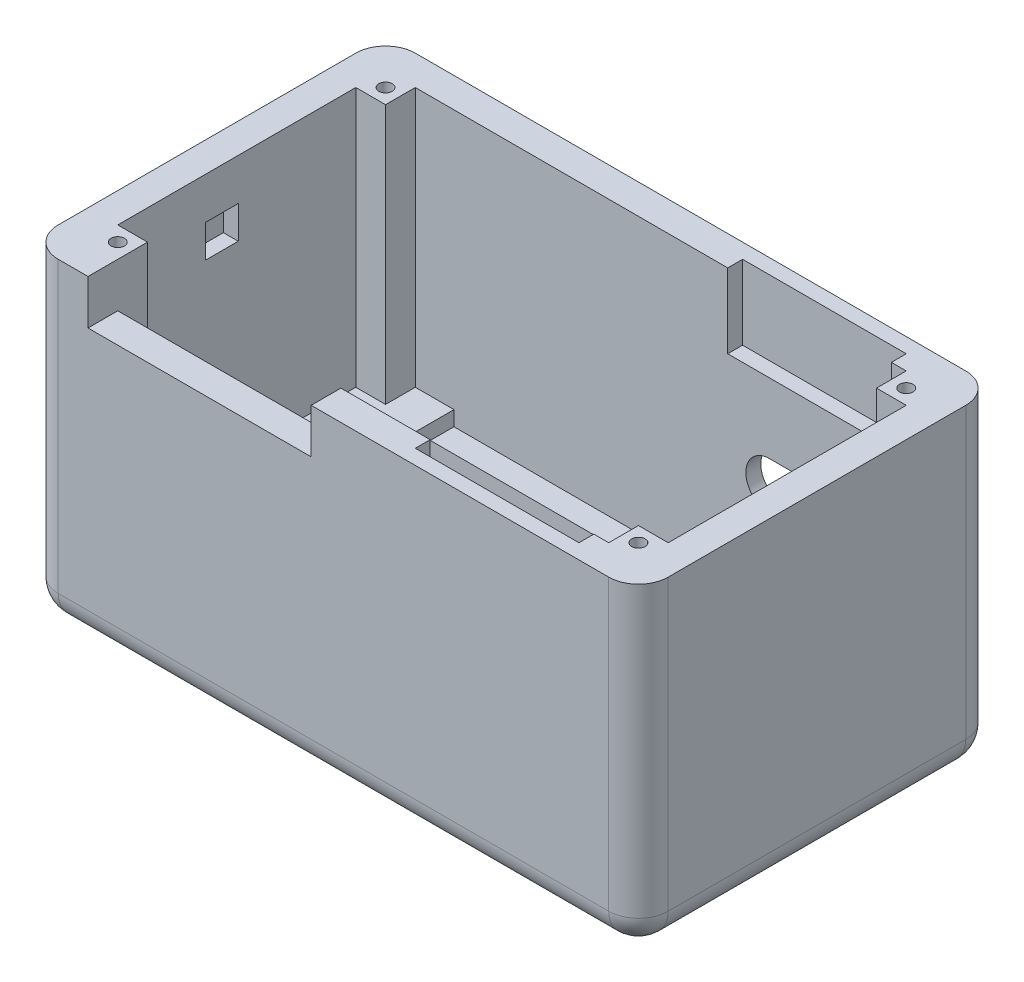
from build123d import *

# Parameters (mm, degrees)
SKETCH_1_W           = 41
SKETCH_1_H           = 24
EXTRUDE_1_DEPTH      = 21.45
SKETCH_2_W           = 37
SKETCH_2_H           = 20
CUT_EXTRUDE_1_DEPTH  = 18.45
SKETCH_4_W           = 15.21
SKETCH_4_H           = 15.21
CUT_EXTRUDE_2_DEPTH  = 15
SKETCH_6_W           = 15
SKETCH_6_H           = 3
CUT_EXTRUDE_4_DEPTH  = 5
CUT_EXTRUDE_7_DEPTH  = 1
CUT_EXTRUDE_8_DEPTH  = 1
SKETCH_11_W          = 35.5
SKETCH_11_H          = 17.6
CUT_EXTRUDE_10_DEPTH = 1.5
SKETCH_13_W          = 11
SKETCH_13_H          = 1
CUT_EXTRUDE_12_DEPTH = 5
FILLET_2_R           = 2
CHAMFER_2_SIZE       = 2
CHAMFER_2_SIZE_2     = 1.5
SKETCH_19_W          = 2.2
SKETCH_19_H          = 2.2
CUT_EXTRUDE_16_DEPTH = 1
SKETCH_21_W          = 3.8
SKETCH_21_H          = 1
SKETCH_21_W_2        = 3
EXTRUDE_4_DEPTH      = 3
FILLET_8_R           = 1
SKETCH_24_W          = 13.2
SKETCH_24_H          = 9.5
CUT_EXTRUDE_17_DEPTH = 1
EXTRUDE_6_REACH      = 80.427
SKETCH_27_W          = 4.6
SKETCH_27_H          = 1
SKETCH_28_W          = 2
SKETCH_28_H          = 2
EXTRUDE_7_DEPTH      = 17.45
SKETCH_29_R          = 0.45
CUT_EXTRUDE_18_DEPTH = 6


with BuildPart() as part:
    # 草图1 → 凸台-拉伸1 (new body)
    with BuildSketch(Plane(origin=(0, 0, 0), x_dir=(1, 0, 0), z_dir=(0, 1, 0))):
        with Locations((-51.657577391, -18.750418409)):
            Rectangle(SKETCH_1_W, SKETCH_1_H)
    extrude(amount=EXTRUDE_1_DEPTH)

    # 草图2 → 切除-拉伸1 (cut)
    with BuildSketch(Plane(origin=(0, 21.45, 0), x_dir=(1, 0, 0), z_dir=(0, 1, 0))):
        with Locations((-51.657577391, -18.750418409)):
            Rectangle(SKETCH_2_W, SKETCH_2_H)
    extrude(amount=-CUT_EXTRUDE_1_DEPTH, mode=Mode.SUBTRACT)

    # 草图4 → 切除-拉伸2 (cut)
    with BuildSketch(Plane(origin=(0, 0, 0), x_dir=(-1, 0, 0), z_dir=(0, -1, 0))):
        with Locations((61.352577391, -19.145418409)):
            Rectangle(SKETCH_4_W, SKETCH_4_H)
    extrude(amount=-CUT_EXTRUDE_2_DEPTH, mode=Mode.SUBTRACT)

    # 草图6 → 切除-拉伸4 (cut)
    with BuildSketch(Plane.XY.offset(30.750418409)):
        with Locations((-60.657577391, 19.95)):
            Rectangle(SKETCH_6_W, SKETCH_6_H)
    extrude(amount=-CUT_EXTRUDE_4_DEPTH, mode=Mode.SUBTRACT)

    # 草图7 → 切除-拉伸7 (cut)
    with BuildSketch(Plane(origin=(0, 0, 6.750418409), x_dir=(-1, 0, 0), z_dir=(0, 0, -1))):
        with BuildLine():
            Line((44.337577391, 6.55), (38.137577391, 6.55))
            ThreePointArc((38.137577391, 6.55), (34.537577391, 10.15), (38.137577391, 13.75))
            Line((38.137577391, 13.75), (44.337577391, 13.75))
            ThreePointArc((44.337577391, 13.75), (47.937577391, 10.15), (44.337577391, 6.55))
        make_face()
    extrude(amount=-CUT_EXTRUDE_7_DEPTH, mode=Mode.SUBTRACT)

    # 草图9 → 切除-拉伸8 (cut)
    with BuildSketch(Plane(origin=(0, 0, 7.750418409), x_dir=(-1, 0, 0), z_dir=(0, 0, -1))):
        with BuildLine():
            Line((44.337577391, 8.55), (38.537577391, 8.55))
            ThreePointArc((38.537577391, 8.55), (36.937577391, 10.15), (38.537577391, 11.75))
            Line((38.537577391, 11.75), (44.337577391, 11.75))
            ThreePointArc((44.337577391, 11.75), (45.937577391, 10.15), (44.337577391, 8.55))
        make_face()
    extrude(amount=-CUT_EXTRUDE_8_DEPTH, mode=Mode.SUBTRACT)

    # 草图11 → 切除-拉伸10 (cut)
    with BuildSketch(Plane(origin=(0, 3, 0), x_dir=(1, 0, 0), z_dir=(0, 1, 0))):
        with Locations((-52.407577391, -19.140418409)):
            Rectangle(SKETCH_11_W, SKETCH_11_H)
    extrude(amount=-CUT_EXTRUDE_10_DEPTH, mode=Mode.SUBTRACT)

    # 草图13 → 切除-拉伸12 (cut)
    with BuildSketch(Plane(origin=(0, 21.45, 0), x_dir=(1, 0, 0), z_dir=(0, 1, 0))):
        with Locations((-41.657577391, -29.250418409)):
            Rectangle(SKETCH_13_W, SKETCH_13_H)
        with Locations((-41.657577391, -8.250418409)):
            Rectangle(SKETCH_13_W, SKETCH_13_H)
    extrude(amount=-CUT_EXTRUDE_12_DEPTH, mode=Mode.SUBTRACT)

    # 圆角2
    fillet_2_edges = [part.edges().sort_by_distance(p)[0] for p in [
        (-72.157577391, 0, 18.750418409),
        (-51.657577391, 0, 30.750418409),
        (-31.157577391, 0, 18.750418409),
        (-51.657577391, 0, 6.750418409),
        (-72.157577391, 10.725, 6.750418409),
        (-72.157577391, 10.725, 30.750418409),
        (-31.157577391, 10.725, 30.750418409),
        (-31.157577391, 10.725, 6.750418409),
    ]]
    fillet(fillet_2_edges, radius=FILLET_2_R)

    # 倒角2
    # the kernel refuses this chamfer: 2, 1.5 mm, written as the material it takes off along each edge
    with BuildSketch(Plane(origin=(-53.747577391, 0, 26.750418409), x_dir=(0, -0.02324952774876386, 0.9997296931968459), z_dir=(-1, 0, 0)), Plane(origin=(-53.747577391, 0, 11.540418409), x_dir=(0.9997296931968459, -0.02324952774876386, 0), z_dir=(0, 0, 1)), Plane(origin=(-68.957577391, 0, 11.540418409), x_dir=(0, -0.02324952774876386, -0.9997296931968459), z_dir=(1, 0, 0)), Plane(origin=(-68.957577391, 0, 26.750418409), x_dir=(-0.9997296931968459, -0.02324952774876394, 0), z_dir=(0, 0, -1))) as chamfer_2_piece_1:
        Polygon((CHAMFER_2_SIZE * 0.999729693197, CHAMFER_2_SIZE * 0.0232495277488), (-CHAMFER_2_SIZE_2 * 0.0232495277488, CHAMFER_2_SIZE_2 * 0.999729693197), (0, 0), align=None)
    extrude(amount=15.21, mode=Mode.SUBTRACT)
    with BuildSketch(Plane(origin=(-48.58618223, 0, 26.750418409), x_dir=(0, -0.02324952774876386, 0.9997296931968459), z_dir=(-1, 0, 0))) as chamfer_2_piece_2a_section:
        Polygon((CHAMFER_2_SIZE * 0.999729693197, CHAMFER_2_SIZE * 0.0232495277488), (-CHAMFER_2_SIZE_2 * 0.0232495277488, CHAMFER_2_SIZE_2 * 0.999729693197), (0, 0), align=None)
    chamfer_2_piece_2a = extrude(amount=20.37139516, mode=Mode.PRIVATE)
    chamfer_2_piece_2a = split(chamfer_2_piece_2a, bisect_by=Plane(origin=(-53.747577391, 0.488589108, 27.415308917), z_dir=(1, 0, 0)), keep=Keep.TOP, mode=Mode.PRIVATE)
    with BuildSketch(Plane(origin=(-53.747577391, 0, 11.540418409), x_dir=(0.9997296931968459, -0.02324952774876386, 0), z_dir=(0, 0, 1))) as chamfer_2_piece_2b_section:
        Polygon((CHAMFER_2_SIZE * 0.999729693197, CHAMFER_2_SIZE * 0.0232495277488), (-CHAMFER_2_SIZE_2 * 0.0232495277488, CHAMFER_2_SIZE_2 * 0.999729693197), (0, 0), align=None)
    chamfer_2_piece_2b = extrude(amount=20.37139516, mode=Mode.PRIVATE)
    chamfer_2_piece_2b = split(chamfer_2_piece_2b, bisect_by=Plane(origin=(-53.082686882, 0.488589108, 26.750418409), z_dir=(0, 0, 1)), keep=Keep.TOP, mode=Mode.PRIVATE)
    chamfer_2_piece_2 = chamfer_2_piece_2a & chamfer_2_piece_2b
    add(chamfer_2_piece_2, mode=Mode.SUBTRACT)
    with BuildSketch(Plane(origin=(-68.957577391, 0, 31.911813569), x_dir=(-0.9997296931968459, -0.02324952774876394, 0), z_dir=(0, 0, -1))) as chamfer_2_piece_3a_section:
        Polygon((CHAMFER_2_SIZE * 0.999729693197, CHAMFER_2_SIZE * 0.0232495277488), (-CHAMFER_2_SIZE_2 * 0.0232495277488, CHAMFER_2_SIZE_2 * 0.999729693197), (0, 0), align=None)
    chamfer_2_piece_3a = extrude(amount=20.37139516, mode=Mode.PRIVATE)
    chamfer_2_piece_3a = split(chamfer_2_piece_3a, bisect_by=Plane(origin=(-69.622467899, 0.488589108, 26.750418409), z_dir=(0, 0, 1)), keep=Keep.TOP, mode=Mode.PRIVATE)
    with BuildSketch(Plane(origin=(-53.747577391, 0, 26.750418409), x_dir=(0, -0.02324952774876386, 0.9997296931968459), z_dir=(-1, 0, 0))) as chamfer_2_piece_3b_section:
        Polygon((CHAMFER_2_SIZE * 0.999729693197, CHAMFER_2_SIZE * 0.0232495277488), (-CHAMFER_2_SIZE_2 * 0.0232495277488, CHAMFER_2_SIZE_2 * 0.999729693197), (0, 0), align=None)
    chamfer_2_piece_3b = extrude(amount=20.37139516, mode=Mode.PRIVATE)
    chamfer_2_piece_3b = split(chamfer_2_piece_3b, bisect_by=Plane(origin=(-68.957577391, 0.488589108, 27.415308917), z_dir=(-1, 0, 0)), keep=Keep.TOP, mode=Mode.PRIVATE)
    chamfer_2_piece_3 = chamfer_2_piece_3a & chamfer_2_piece_3b
    add(chamfer_2_piece_3, mode=Mode.SUBTRACT)
    with BuildSketch(Plane(origin=(-53.747577391, 0, 6.379023249), x_dir=(0.9997296931968459, -0.02324952774876386, 0), z_dir=(0, 0, 1))) as chamfer_2_piece_4a_section:
        Polygon((CHAMFER_2_SIZE * 0.999729693197, CHAMFER_2_SIZE * 0.0232495277488), (-CHAMFER_2_SIZE_2 * 0.0232495277488, CHAMFER_2_SIZE_2 * 0.999729693197), (0, 0), align=None)
    chamfer_2_piece_4a = extrude(amount=20.37139516, mode=Mode.PRIVATE)
    chamfer_2_piece_4a = split(chamfer_2_piece_4a, bisect_by=Plane(origin=(-53.082686882, 0.488589108, 11.540418409), z_dir=(0, 0, -1)), keep=Keep.TOP, mode=Mode.PRIVATE)
    with BuildSketch(Plane(origin=(-68.957577391, 0, 11.540418409), x_dir=(0, -0.02324952774876386, -0.9997296931968459), z_dir=(1, 0, 0))) as chamfer_2_piece_4b_section:
        Polygon((CHAMFER_2_SIZE * 0.999729693197, CHAMFER_2_SIZE * 0.0232495277488), (-CHAMFER_2_SIZE_2 * 0.0232495277488, CHAMFER_2_SIZE_2 * 0.999729693197), (0, 0), align=None)
    chamfer_2_piece_4b = extrude(amount=20.37139516, mode=Mode.PRIVATE)
    chamfer_2_piece_4b = split(chamfer_2_piece_4b, bisect_by=Plane(origin=(-53.747577391, 0.488589108, 10.875527901), z_dir=(1, 0, 0)), keep=Keep.TOP, mode=Mode.PRIVATE)
    chamfer_2_piece_4 = chamfer_2_piece_4a & chamfer_2_piece_4b
    add(chamfer_2_piece_4, mode=Mode.SUBTRACT)
    with BuildSketch(Plane(origin=(-68.957577391, 0, 26.750418409), x_dir=(-0.9997296931968459, -0.02324952774876394, 0), z_dir=(0, 0, -1))) as chamfer_2_piece_5a_section:
        Polygon((CHAMFER_2_SIZE * 0.999729693197, CHAMFER_2_SIZE * 0.0232495277488), (-CHAMFER_2_SIZE_2 * 0.0232495277488, CHAMFER_2_SIZE_2 * 0.999729693197), (0, 0), align=None)
    chamfer_2_piece_5a = extrude(amount=20.37139516, mode=Mode.PRIVATE)
    chamfer_2_piece_5a = split(chamfer_2_piece_5a, bisect_by=Plane(origin=(-69.622467899, 0.488589108, 11.540418409), z_dir=(0, 0, -1)), keep=Keep.TOP, mode=Mode.PRIVATE)
    with BuildSketch(Plane(origin=(-74.118972551, 0, 11.540418409), x_dir=(0, -0.02324952774876386, -0.9997296931968459), z_dir=(1, 0, 0))) as chamfer_2_piece_5b_section:
        Polygon((CHAMFER_2_SIZE * 0.999729693197, CHAMFER_2_SIZE * 0.0232495277488), (-CHAMFER_2_SIZE_2 * 0.0232495277488, CHAMFER_2_SIZE_2 * 0.999729693197), (0, 0), align=None)
    chamfer_2_piece_5b = extrude(amount=20.37139516, mode=Mode.PRIVATE)
    chamfer_2_piece_5b = split(chamfer_2_piece_5b, bisect_by=Plane(origin=(-68.957577391, 0.488589108, 10.875527901), z_dir=(-1, 0, 0)), keep=Keep.TOP, mode=Mode.PRIVATE)
    chamfer_2_piece_5 = chamfer_2_piece_5a & chamfer_2_piece_5b
    add(chamfer_2_piece_5, mode=Mode.SUBTRACT)

    # 草图19 → 切除-拉伸16 (cut)
    with BuildSketch(Plane(origin=(-70.157577391, 0, 0), x_dir=(0, 0, -1), z_dir=(1, 0, 0))):
        with Locations((-19.750418409, 17.55)):
            Rectangle(SKETCH_19_W, SKETCH_19_H)
    extrude(amount=-CUT_EXTRUDE_16_DEPTH, mode=Mode.SUBTRACT)

    # 草图21 → 凸台-拉伸4 (add)
    with BuildSketch(Plane.ZY.offset(33.157577391)):
        with Locations((10.650418409, 3.5)):
            Rectangle(SKETCH_21_W, SKETCH_21_H)
        with Locations((27.250418409, 3.5)):
            Rectangle(SKETCH_21_W_2, SKETCH_21_H)
    extrude(amount=EXTRUDE_4_DEPTH)

    # 圆角8
    # the kernel refuses this fillet: 1 mm, written as the material it takes off along each edge
    with BuildSketch(Plane(origin=(-34.657577391, 3, 28.250418409), x_dir=(1, 0, 0), z_dir=(0, 0, -1))) as fillet_8_piece_1_section:
        with BuildLine():
            CenterArc((FILLET_8_R, FILLET_8_R), FILLET_8_R, 180, 90)
            Line((0, FILLET_8_R), (0, 0))
            Line((0, 0), (FILLET_8_R, 0))
        make_face()
    fillet_8_piece_1 = extrude(amount=15.7, mode=Mode.PRIVATE)
    fillet_8_piece_1 = split(fillet_8_piece_1, bisect_by=Plane(origin=(-34.454104261, 2.75304895, 27.940418409), z_dir=(0, 0, -1)), keep=Keep.TOP, mode=Mode.PRIVATE)
    fillet_8_piece_1 = split(fillet_8_piece_1, bisect_by=Plane(origin=(-34.454104261, 2.75304895, 25.750418409), z_dir=(0, 0, 1)), keep=Keep.TOP, mode=Mode.PRIVATE)
    fillet_8_piece_1 = split(fillet_8_piece_1, bisect_by=Plane(origin=(-34.454104261, 3, 26.845418409), z_dir=(0, -1, 0)), keep=Keep.TOP, mode=Mode.PRIVATE)
    add(fillet_8_piece_1, mode=Mode.SUBTRACT)
    with BuildSketch(Plane(origin=(-34.657577391, 3, 25.750418409), x_dir=(1, 0, 0), z_dir=(0, 0, -1))) as fillet_8_piece_2_section:
        with BuildLine():
            CenterArc((FILLET_8_R, FILLET_8_R), FILLET_8_R, 180, 90)
            Line((0, FILLET_8_R), (0, 0))
            Line((0, 0), (FILLET_8_R, 0))
        make_face()
    fillet_8_piece_2 = extrude(amount=13.2, mode=Mode.PRIVATE)
    fillet_8_piece_2 = split(fillet_8_piece_2, bisect_by=Plane(origin=(-34.454104261, 3, 19.150418409), z_dir=(0, -1, 0)), keep=Keep.TOP, mode=Mode.PRIVATE)
    add(fillet_8_piece_2, mode=Mode.SUBTRACT)
    with BuildSketch(Plane(origin=(-34.657577391, 3, 25.750418409), x_dir=(1, 0, 0), z_dir=(0, 0, -1))) as fillet_8_piece_3_section:
        with BuildLine():
            CenterArc((FILLET_8_R, FILLET_8_R), FILLET_8_R, 180, 90)
            Line((0, FILLET_8_R), (0, 0))
            Line((0, 0), (FILLET_8_R, 0))
        make_face()
    fillet_8_piece_3 = extrude(amount=15.7, mode=Mode.PRIVATE)
    fillet_8_piece_3 = split(fillet_8_piece_3, bisect_by=Plane(origin=(-34.454104261, 2.75304895, 10.340418409), z_dir=(0, 0, 1)), keep=Keep.TOP, mode=Mode.PRIVATE)
    fillet_8_piece_3 = split(fillet_8_piece_3, bisect_by=Plane(origin=(-34.454104261, 2.75304895, 12.550418409), z_dir=(0, 0, -1)), keep=Keep.TOP, mode=Mode.PRIVATE)
    fillet_8_piece_3 = split(fillet_8_piece_3, bisect_by=Plane(origin=(-34.454104261, 3, 11.445418409), z_dir=(0, -1, 0)), keep=Keep.TOP, mode=Mode.PRIVATE)
    add(fillet_8_piece_3, mode=Mode.SUBTRACT)

    # 草图24 → 切除-拉伸17 (cut)
    with BuildSketch(Plane.ZY.offset(33.157577391)):
        with Locations((19.150418409, 7.75)):
            Rectangle(SKETCH_24_W, SKETCH_24_H)
    extrude(amount=-CUT_EXTRUDE_17_DEPTH, mode=Mode.SUBTRACT)

    # 草图27 → 凸台-拉伸6 (add, up to next)
    with BuildSketch(Plane.XY.offset(8.750418409), mode=Mode.PRIVATE) as extrude_6_sk1:
        with Locations((-67.857577391, 3.5)):
            Rectangle(SKETCH_27_W, SKETCH_27_H)
    extrude_6_tool1 = extrude(extrude_6_sk1.sketch, amount=EXTRUDE_6_REACH, mode=Mode.PRIVATE) - part.part
    add(extrude_6_tool1.solids().sort_by_distance((-67.857577, 3.5, 8.750418))[0])

    # 草图28 → 凸台-拉伸7 (add)
    with BuildSketch(Plane(origin=(0, 4, 0), x_dir=(1, 0, 0), z_dir=(0, 1, 0))):
        with Locations((-69.157577391, -9.750418409)):
            Rectangle(SKETCH_28_W, SKETCH_28_H)
        with Locations((-34.157577391, -9.750418409)):
            Rectangle(SKETCH_28_W, SKETCH_28_H)
        with Locations((-69.157577391, -27.750418409)):
            Rectangle(SKETCH_28_W, SKETCH_28_H)
        with Locations((-34.157577391, -27.750418409)):
            Rectangle(SKETCH_28_W, SKETCH_28_H)
    extrude(amount=EXTRUDE_7_DEPTH)

    # 草图29 → 切除-拉伸18 (cut)
    with BuildSketch(Plane(origin=(0, 21.45, 0), x_dir=(1, 0, 0), z_dir=(0, 1, 0))):
        with Locations(Location((-69.157577391, -9.750418409, 0), (0, 0, 270))):
            Circle(SKETCH_29_R)
        with Locations(Location((-69.157577391, -27.750418409, 0), (0, 0, 270))):
            Circle(SKETCH_29_R)
        with Locations(Location((-34.157577391, -9.750418409, 0), (0, 0, 270))):
            Circle(SKETCH_29_R)
        with Locations(Location((-34.157577391, -27.750418409, 0), (0, 0, 270))):
            Circle(SKETCH_29_R)
    extrude(amount=-CUT_EXTRUDE_18_DEPTH, mode=Mode.SUBTRACT)


solid = part.part
